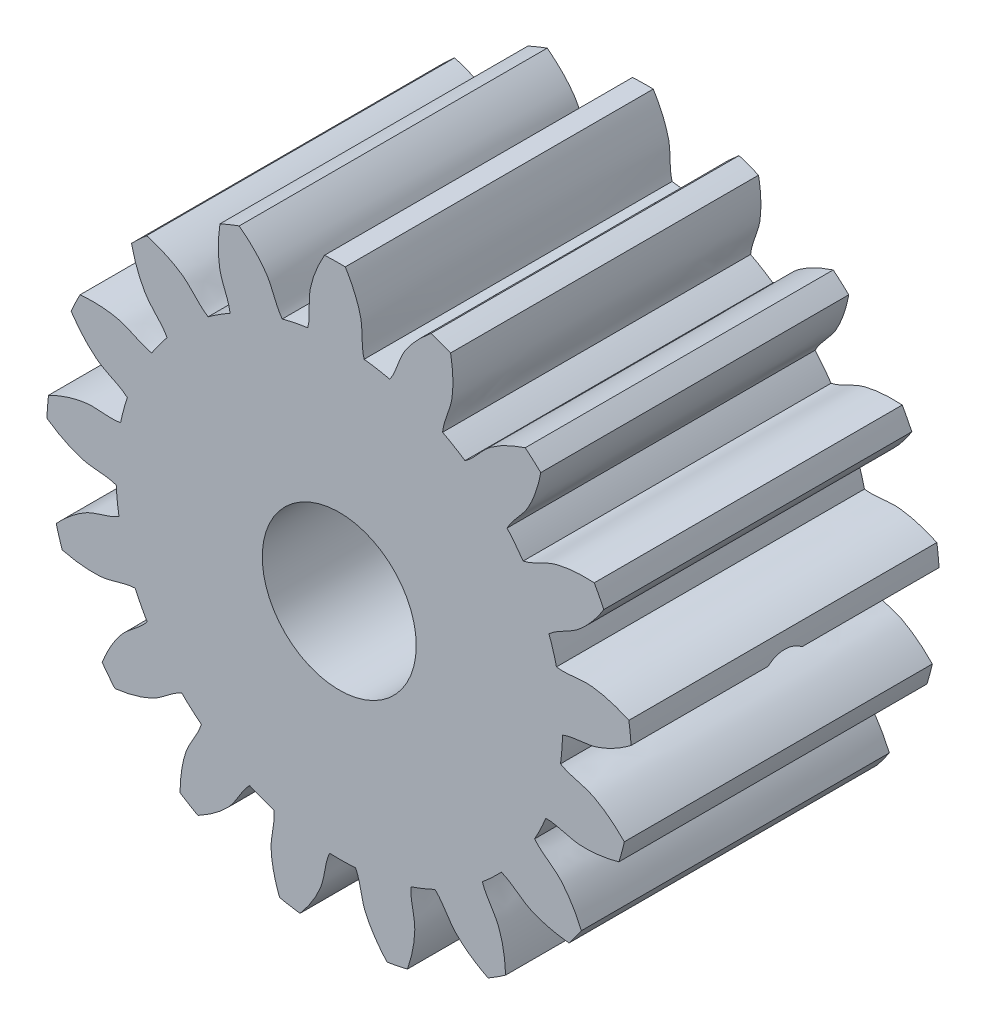
from build123d import *

# Parameters (mm, degrees)
SKETCH_1_R               = 14.5
SKETCH_1_R_2             = 5
EXTRUDE_1_DEPTH          = 20
EXTRUDE_2_DEPTH          = 20
PATTERN_CIRCULAR_1_COUNT = 17
SKETCH_5_R               = 1.75
CUT_EXTRUDE_1_DEPTH      = 50


with BuildPart() as part:
    # 草图1 → 凸台-拉伸1 (new body)
    with BuildSketch(Plane.XY):
        Circle(SKETCH_1_R)
        Circle(SKETCH_1_R_2, mode=Mode.SUBTRACT)
    extrude(amount=EXTRUDE_1_DEPTH)

    # 草图2 → 凸台-拉伸2 (add)
    with BuildSketch(Plane.XY):
        with BuildLine():
            ThreePointArc((18.806655179, 2.703649565), (18.890720164, 2.03486896), (18.951010344, 1.363527383))
            add(Edge.make_bspline(
                [(18.951010344, 1.363527383), (18.579465593, 1.085770146), (18.003875464, 0.708041748), (17.192919935, 0.321555176), (16.120776534, -0.081994227), (15.160225066, -0.021582845), (14.497356765, -0.27685164)],
                knots=[0, 0, 0, 0, 0.289468221, 0.427045393, 0.559833587, 1, 1, 1, 1], degree=3))
            ThreePointArc((14.497356765, -0.27685164), (14.41660223, 1.552926312), (14.105826015, 3.357926807))
            add(Edge.make_bspline(
                [(18.806655179, 2.703649565), (18.384481205, 2.895909076), (17.741652343, 3.142391923), (16.866992209, 3.347307493), (15.733502102, 3.513270657), (14.807851296, 3.249681501), (14.105826015, 3.357926807)],
                knots=[0, 0, 0, 0, 0.289468221, 0.427045393, 0.559833587, 1, 1, 1, 1], degree=3))
        make_face()
    extrude_2 = extrude(amount=EXTRUDE_2_DEPTH)

    # 阵列(圆周)1: 凸台-拉伸2 ×17 about axis
    pattern_circular_1_axis = Axis((0, 0, 20), (0, 0, -1))
    for i in range(1, PATTERN_CIRCULAR_1_COUNT):
        add(extrude_2.rotate(pattern_circular_1_axis, i * 360 / PATTERN_CIRCULAR_1_COUNT))

    # 草图5 → 切除-拉伸1 (cut, symmetric)
    with BuildSketch(Plane(origin=(0, 0, 0), x_dir=(0, 0, -1), z_dir=(1, 0, 0))):
        with Locations((-10, 0)):
            Circle(SKETCH_5_R)
    extrude(amount=CUT_EXTRUDE_1_DEPTH, both=True, mode=Mode.SUBTRACT)


solid = part.part
